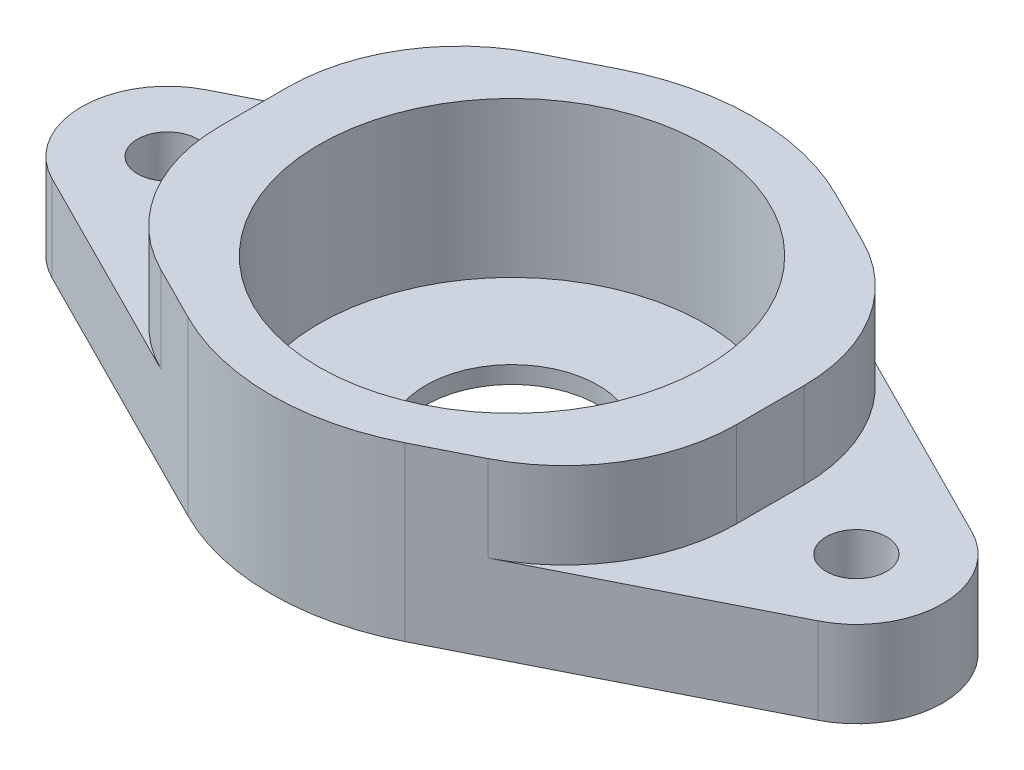
from build123d import *

# Parameters (mm, degrees)
SKETCH2_R               = 1.75
BOSS_EXTRUDE1_DEPTH     = 10
SKETCH3_R               = 11.2
CUT_EXTRUDE1_DEPTH      = 9
CUT_EXTRUDE2_DEPTH      = 31.347981811
CUT_EXTRUDE2_DEPTH_BACK = 31.347981811
SKETCH4_W               = 10
SKETCH4_H               = 5
FILLET1_R               = 10
CUT_EXTRUDE3_DEPTH      = 31.033314835
CUT_EXTRUDE3_DEPTH_BACK = 31.033314835
SKETCH5_R               = 5


with BuildPart() as part:
    # Sketch2 → Boss-Extrude1 (new body)
    with BuildSketch(Plane(origin=(0, 0, 0), x_dir=(1, 0, 0), z_dir=(0, 1, 0))):
        with BuildLine():
            Line((-22.25, 4.465142775), (-6.3, 12.50239977))
            ThreePointArc((-6.3, 12.50239977), (0, 14), (6.3, 12.50239977))
            Line((6.3, 12.50239977), (22.25, 4.465142775))
            ThreePointArc((22.25, 4.465142775), (25, 0), (22.25, -4.465142775))
            Line((22.25, -4.465142775), (6.3, -12.50239977))
            ThreePointArc((6.3, -12.50239977), (0, -14), (-6.3, -12.50239977))
            Line((-6.3, -12.50239977), (-22.25, -4.465142775))
            ThreePointArc((-22.25, -4.465142775), (-25, 0), (-22.25, 4.465142775))
        make_face()
        with Locations((-20, 0)):
            Circle(SKETCH2_R, mode=Mode.SUBTRACT)
        with Locations((20, 0)):
            Circle(SKETCH2_R, mode=Mode.SUBTRACT)
    extrude(amount=BOSS_EXTRUDE1_DEPTH)

    # Sketch3 → Cut-Extrude1 (cut)
    with BuildSketch(Plane(origin=(0, 10, 0), x_dir=(1, 0, 0), z_dir=(0, 1, 0))):
        Circle(SKETCH3_R)
    extrude(amount=-CUT_EXTRUDE1_DEPTH, mode=Mode.SUBTRACT)

    # Sketch4 → Cut-Extrude2 (cut, two sides: drawn at the far end of the back side and taken through both)
    with BuildSketch(Plane.XY.offset(-CUT_EXTRUDE2_DEPTH_BACK)):
        with Locations((-20, 7.5)):
            Rectangle(SKETCH4_W, SKETCH4_H)
        with Locations((20, 7.5)):
            Rectangle(SKETCH4_W, SKETCH4_H)
    extrude(amount=CUT_EXTRUDE2_DEPTH + CUT_EXTRUDE2_DEPTH_BACK, mode=Mode.SUBTRACT)

    # Fillet1
    fillet1_edges = [part.edges().sort_by_distance(p)[0] for p in [
        (15, 7.5, 8.118441409),
        (15, 7.5, -8.118441409),
        (-15, 7.5, -8.118441409),
        (-15, 7.5, 8.118441409),
    ]]
    fillet(fillet1_edges, radius=FILLET1_R)

    # Sketch5 → Cut-Extrude3 (cut, two sides: drawn at the far end of the back side and taken through both)
    with BuildSketch(Plane(origin=(0, 1, 0), x_dir=(1, 0, 0), z_dir=(0, 1, 0)).offset(-CUT_EXTRUDE3_DEPTH_BACK)):
        Circle(SKETCH5_R)
    extrude(amount=CUT_EXTRUDE3_DEPTH + CUT_EXTRUDE3_DEPTH_BACK, mode=Mode.SUBTRACT)


solid = part.part
